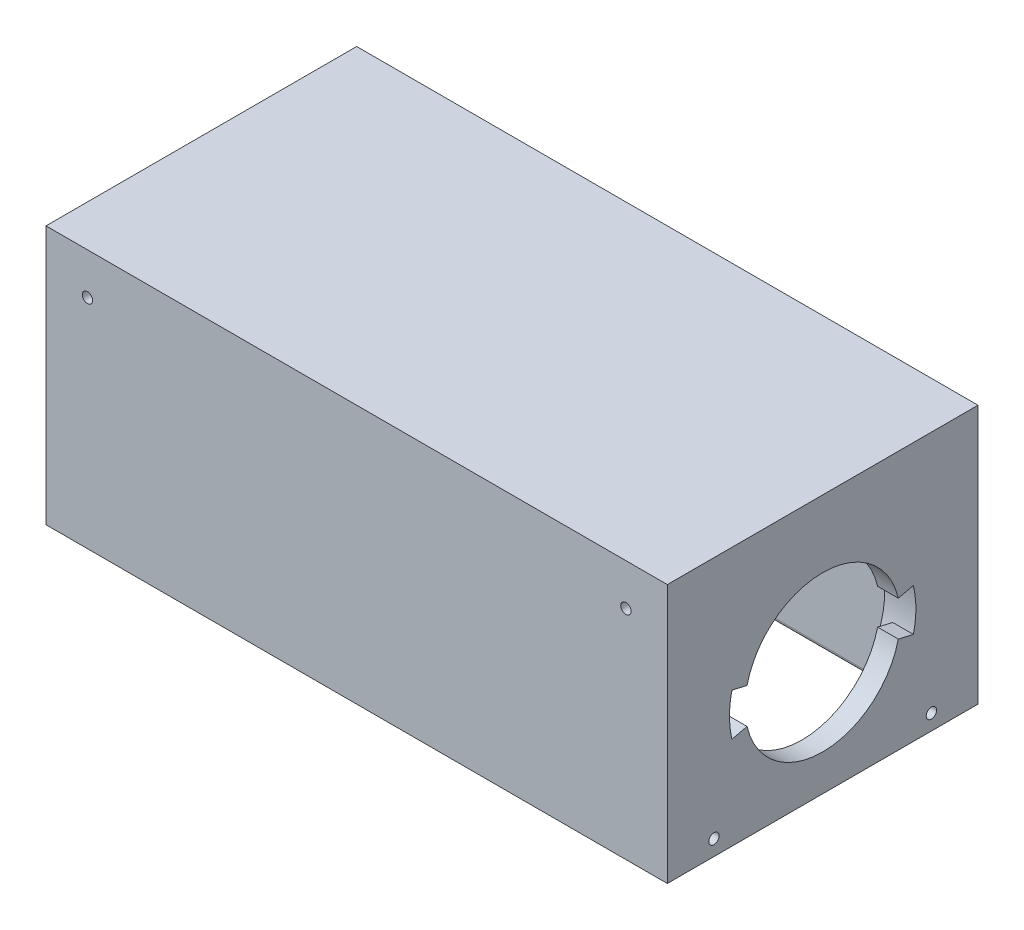
from build123d import *

# Parameters (mm, degrees)
SKETCH1_W           = 300
SKETCH1_H           = 150
BOSS_EXTRUDE1_DEPTH = 125
SKETCH2_W           = 270
SKETCH2_H           = 120
CUT_EXTRUDE1_DEPTH  = 110
SKETCH4_R           = 2.5
CUT_EXTRUDE5_DEPTH  = 350
SKETCH6_R           = 2.5
CUT_EXTRUDE6_DEPTH  = 175
FILLET1_R           = 5
FILLET2_R           = 5
FILLET3_R           = 5
FILLET4_R           = 5
FILLET5_R           = 2
SKETCH7_R           = 37.5
CUT_EXTRUDE7_DEPTH  = 25
SKETCH8_R           = 45
CUT_EXTRUDE8_DEPTH  = 5
SKETCH9_R           = 37.5
CUT_EXTRUDE9_DEPTH  = 20
BOSS_EXTRUDE2_DEPTH = 5
SKETCH12_R          = 2.0701
CUT_EXTRUDE10_DEPTH = 12.7


with BuildPart() as part:
    # Sketch1 → Boss-Extrude1 (new body)
    with BuildSketch(Plane(origin=(0, 0, 0), x_dir=(1, 0, 0), z_dir=(0, 1, 0))):
        Rectangle(SKETCH1_W, SKETCH1_H)
    extrude(amount=BOSS_EXTRUDE1_DEPTH)

    # Sketch2 → Cut-Extrude1 (cut)
    with BuildSketch(Plane.XZ):
        Rectangle(SKETCH2_W, SKETCH2_H)
    extrude(amount=-CUT_EXTRUDE1_DEPTH, mode=Mode.SUBTRACT)

    # Sketch4 → Cut-Extrude5 (cut)
    with BuildSketch(Plane(origin=(150, 0, 0), x_dir=(0, 0, -1), z_dir=(1, 0, 0))):
        with Locations((-52.5, 7.5)):
            Circle(SKETCH4_R)
        with Locations((52.5, 7.5)):
            Circle(SKETCH4_R)
    extrude(amount=-CUT_EXTRUDE5_DEPTH, mode=Mode.SUBTRACT)

    # Sketch6 → Cut-Extrude6 (cut)
    with BuildSketch(Plane.XY.offset(75)):
        with Locations((-130, 105)):
            Circle(SKETCH6_R)
        with Locations((130, 105)):
            Circle(SKETCH6_R)
    extrude(amount=-CUT_EXTRUDE6_DEPTH, mode=Mode.SUBTRACT)

    # Fillet1
    # the kernel refuses this fillet: 5 mm, written as the material it adds along each edge
    with BuildSketch(Plane(origin=(147.5, 110, -60), x_dir=(0, -1, 0), z_dir=(-1, 0, 0))) as fillet1_piece_1_section:
        with BuildLine():
            CenterArc((FILLET1_R, FILLET1_R), FILLET1_R, 180, 90)
            Line((0, FILLET1_R), (0, 0))
            Line((0, 0), (FILLET1_R, 0))
        make_face()
    fillet1_piece_1 = extrude(amount=295, mode=Mode.PRIVATE)
    fillet1_piece_1 = fillet1_piece_1 - Plane(origin=(130, 105, -58.868024429), x_dir=(1, 0, 0), z_dir=(0, 0, 1)) * Cylinder(2.5, 610, mode=Mode.PRIVATE)
    fillet1_piece_1 = fillet1_piece_1 - Plane(origin=(-130, 105, -58.868024429), x_dir=(1, 0, 0), z_dir=(0, 0, 1)) * Cylinder(2.5, 610, mode=Mode.PRIVATE)
    add(fillet1_piece_1)

    # Fillet2
    # the kernel refuses this fillet: 5 mm, written as the material it adds along each edge
    with BuildSketch(Plane(origin=(-147.5, 110, 60), x_dir=(0, 0, -1), z_dir=(1, 0, 0))) as fillet2_piece_1_section:
        with BuildLine():
            CenterArc((FILLET2_R, -FILLET2_R), FILLET2_R, 90, 90)
            Line((0, -FILLET2_R), (0, 0))
            Line((0, 0), (FILLET2_R, 0))
        make_face()
    fillet2_piece_1 = extrude(amount=295, mode=Mode.PRIVATE)
    fillet2_piece_1 = fillet2_piece_1 - Plane(origin=(-130, 105, 58.868024429), x_dir=(1, 0, 0), z_dir=(0, 0, 1)) * Cylinder(2.5, 610, mode=Mode.PRIVATE)
    fillet2_piece_1 = fillet2_piece_1 - Plane(origin=(130, 105, 58.868024429), x_dir=(1, 0, 0), z_dir=(0, 0, 1)) * Cylinder(2.5, 610, mode=Mode.PRIVATE)
    add(fillet2_piece_1)

    # Fillet3
    # the kernel refuses this fillet: 5 mm, written as the material it adds along each edge
    with BuildSketch(Plane(origin=(-135, 0, 60), x_dir=(0, 0, -1), z_dir=(0, 1, 0))) as fillet3_piece_1_section:
        with BuildLine():
            CenterArc((FILLET3_R, -FILLET3_R), FILLET3_R, 90, 90)
            Line((0, -FILLET3_R), (0, 0))
            Line((0, 0), (FILLET3_R, 0))
        make_face()
    fillet3_piece_1 = extrude(amount=105, mode=Mode.PRIVATE)
    fillet3_piece_1 = fillet3_piece_1 - Plane(origin=(-130, 105, 58.86600748), x_dir=(1, 0, 0), z_dir=(0, 0, 1)) * Cylinder(2.5, 230, mode=Mode.PRIVATE)
    add(fillet3_piece_1)
    with BuildSketch(Plane(origin=(-135, 105, 55), x_dir=(0, 0, 1), z_dir=(0, -1, 0))) as fillet3_piece_2_section:
        with BuildLine():
            CenterArc((5 - FILLET3_R, -FILLET3_R), FILLET3_R, 0, 90)
            Line((5 - FILLET3_R, 0), (5, 0))
            Line((5, 0), (5, -FILLET3_R))
        make_face()
    fillet3_piece_2 = revolve(axis=Axis((-135, 105, 55), (-1, 0, 0)), revolution_arc=90, mode=Mode.PRIVATE)
    fillet3_piece_2 = fillet3_piece_2 - Plane(origin=(-130, 105, 57.577819165), x_dir=(1, 0, 0), z_dir=(0, 0, 1)) * Cylinder(2.5, 20, mode=Mode.PRIVATE)
    add(fillet3_piece_2)
    with BuildSketch(Plane(origin=(-135, 0, -60), x_dir=(0, 0, 1), z_dir=(0, 1, 0))) as fillet3_piece_3_section:
        with BuildLine():
            CenterArc((FILLET3_R, FILLET3_R), FILLET3_R, 180, 90)
            Line((0, FILLET3_R), (0, 0))
            Line((0, 0), (FILLET3_R, 0))
        make_face()
    fillet3_piece_3 = extrude(amount=105, mode=Mode.PRIVATE)
    fillet3_piece_3 = fillet3_piece_3 - Plane(origin=(-130, 105, -58.86600748), x_dir=(1, 0, 0), z_dir=(0, 0, 1)) * Cylinder(2.5, 231, mode=Mode.PRIVATE)
    add(fillet3_piece_3)
    with BuildSketch(Plane(origin=(-135, 105, -55), x_dir=(0, 0, -1), z_dir=(0, -1, 0))) as fillet3_piece_4_section:
        with BuildLine():
            CenterArc((5 - FILLET3_R, FILLET3_R), FILLET3_R, 270, 90)
            Line((5, FILLET3_R), (5, 0))
            Line((5, 0), (5 - FILLET3_R, 0))
        make_face()
    fillet3_piece_4 = revolve(axis=Axis((-135, 105, -55), (1, 0, 0)), revolution_arc=90, mode=Mode.PRIVATE)
    fillet3_piece_4 = fillet3_piece_4 - Plane(origin=(-130, 105, -57.577819165), x_dir=(1, 0, 0), z_dir=(0, 0, 1)) * Cylinder(2.5, 20, mode=Mode.PRIVATE)
    add(fillet3_piece_4)
    with BuildSketch(Plane(origin=(-135, 110, -55), x_dir=(0, -1, 0), z_dir=(0, 0, 1))) as fillet3_piece_5:
        with BuildLine():
            CenterArc((FILLET3_R, FILLET3_R), FILLET3_R, 180, 90)
            Line((0, FILLET3_R), (0, 0))
            Line((0, 0), (FILLET3_R, 0))
        make_face()
    extrude(amount=110)

    # Fillet4
    # the kernel refuses this fillet: 5 mm, written as the material it adds along each edge
    with BuildSketch(Plane(origin=(135, 0, -60), x_dir=(0, 0, 1), z_dir=(0, 1, 0))) as fillet4_piece_1_section:
        with BuildLine():
            CenterArc((FILLET4_R, -FILLET4_R), FILLET4_R, 90, 90)
            Line((0, -FILLET4_R), (0, 0))
            Line((0, 0), (FILLET4_R, 0))
        make_face()
    fillet4_piece_1 = extrude(amount=105, mode=Mode.PRIVATE)
    fillet4_piece_1 = fillet4_piece_1 - Plane(origin=(130, 105, -58.866007422), x_dir=(1, 0, 0), z_dir=(0, 0, 1)) * Cylinder(2.5, 231, mode=Mode.PRIVATE)
    add(fillet4_piece_1)
    with BuildSketch(Plane(origin=(135, 105, -55), x_dir=(0, 0, -1), z_dir=(0, -1, 0))) as fillet4_piece_2_section:
        with BuildLine():
            CenterArc((5 - FILLET4_R, -FILLET4_R), FILLET4_R, 0, 90)
            Line((5 - FILLET4_R, 0), (5, 0))
            Line((5, 0), (5, -FILLET4_R))
        make_face()
    fillet4_piece_2 = revolve(axis=Axis((135, 105, -55), (1, 0, 0)), revolution_arc=90, mode=Mode.PRIVATE)
    fillet4_piece_2 = fillet4_piece_2 - Plane(origin=(130, 105, -57.577819011), x_dir=(1, 0, 0), z_dir=(0, 0, 1)) * Cylinder(2.5, 20, mode=Mode.PRIVATE)
    add(fillet4_piece_2)
    with BuildSketch(Plane(origin=(135, 0, 60), x_dir=(0, 0, -1), z_dir=(0, 1, 0))) as fillet4_piece_3_section:
        with BuildLine():
            CenterArc((FILLET4_R, FILLET4_R), FILLET4_R, 180, 90)
            Line((0, FILLET4_R), (0, 0))
            Line((0, 0), (FILLET4_R, 0))
        make_face()
    fillet4_piece_3 = extrude(amount=105, mode=Mode.PRIVATE)
    fillet4_piece_3 = fillet4_piece_3 - Plane(origin=(130, 105, 58.866007422), x_dir=(1, 0, 0), z_dir=(0, 0, 1)) * Cylinder(2.5, 231, mode=Mode.PRIVATE)
    add(fillet4_piece_3)
    with BuildSketch(Plane(origin=(135, 105, 55), x_dir=(0, 0, 1), z_dir=(0, -1, 0))) as fillet4_piece_4_section:
        with BuildLine():
            CenterArc((5 - FILLET4_R, FILLET4_R), FILLET4_R, 270, 90)
            Line((5, FILLET4_R), (5, 0))
            Line((5, 0), (5 - FILLET4_R, 0))
        make_face()
    fillet4_piece_4 = revolve(axis=Axis((135, 105, 55), (-1, 0, 0)), revolution_arc=90, mode=Mode.PRIVATE)
    fillet4_piece_4 = fillet4_piece_4 - Plane(origin=(130, 105, 57.577819011), x_dir=(1, 0, 0), z_dir=(0, 0, 1)) * Cylinder(2.5, 20, mode=Mode.PRIVATE)
    add(fillet4_piece_4)
    with BuildSketch(Plane(origin=(135, 110, 55), x_dir=(-1, 0, 0), z_dir=(0, 0, -1))) as fillet4_piece_5:
        with BuildLine():
            CenterArc((FILLET4_R, -FILLET4_R), FILLET4_R, 90, 90)
            Line((0, -FILLET4_R), (0, 0))
            Line((0, 0), (FILLET4_R, 0))
        make_face()
    extrude(amount=110)

    # Fillet5
    fillet5_edges = [part.edges().sort_by_distance(p)[0] for p in [
        (-133.535533906, 0, 58.535533906),
        (-133.535533906, 0, -58.535533906),
        (135, 0, 0),
        (0, 0, 60),
        (133.535533906, 0, -58.535533906),
        (133.535533906, 0, 58.535533906),
        (-135, 0, 0),
        (0, 0, -60),
    ]]
    fillet(fillet5_edges, radius=FILLET5_R)

    # Sketch7 → Cut-Extrude7 (cut)
    with BuildSketch(Plane(origin=(150, 0, 0), x_dir=(0, 0, -1), z_dir=(1, 0, 0))):
        with Locations((0, 55)):
            Circle(SKETCH7_R)
    extrude(amount=-CUT_EXTRUDE7_DEPTH, mode=Mode.SUBTRACT)

    # Sketch8 → Cut-Extrude8 (cut)
    with BuildSketch(Plane.ZY.offset(-135)):
        with Locations((0, 55)):
            Circle(SKETCH8_R)
    extrude(amount=-CUT_EXTRUDE8_DEPTH, mode=Mode.SUBTRACT)

    # Sketch9 → Cut-Extrude9 (cut)
    with BuildSketch(Plane(origin=(150, 0, 0), x_dir=(0, 0, -1), z_dir=(1, 0, 0))):
        with Locations((0, 55)):
            Circle(SKETCH9_R)
        with BuildLine():
            Line((0, 55), (-43.817091414, 65.25))
            ThreePointArc((-43.817091414, 65.25), (-45, 55), (-43.817091414, 44.75))
            Line((-43.817091414, 44.75), (0, 55))
        make_face()
        with BuildLine():
            ThreePointArc((43.817091414, 65.25), (45, 55), (43.817091414, 44.75))
            Line((43.817091414, 44.75), (0, 55))
            Line((0, 55), (43.817091414, 65.25))
        make_face()
    extrude(amount=-CUT_EXTRUDE9_DEPTH, mode=Mode.SUBTRACT)

    # Sketch10 → Boss-Extrude2 (add)
    with BuildSketch(Plane.ZY.offset(-140)):
        with BuildLine():
            Line((-3.5, 99.863682417), (-3.5, 92.336309405))
            ThreePointArc((-3.5, 92.336309405), (0, 92.5), (3.5, 92.336309405))
            Line((3.5, 92.336309405), (3.5, 99.863682417))
            ThreePointArc((3.5, 99.863682417), (0, 100), (-3.5, 99.863682417))
        make_face()
    extrude(amount=BOSS_EXTRUDE2_DEPTH)

    # Sketch12 → Cut-Extrude10 (cut)
    with BuildSketch(Plane.XZ):
        with Locations(Location((144.7549, 69.7549, 0), (0, 0, 270))):
            Circle(SKETCH12_R)
        with Locations(Location((144.7549, -69.7549, 0), (0, 0, 90))):
            Circle(SKETCH12_R)
        with Locations(Location((-144.7549, -69.7549, 0), (0, 0, 270))):
            Circle(SKETCH12_R)
        with Locations(Location((-144.7549, 69.7549, 0), (0, 0, 90))):
            Circle(SKETCH12_R)
    extrude(amount=-CUT_EXTRUDE10_DEPTH, mode=Mode.SUBTRACT)


solid = part.part
